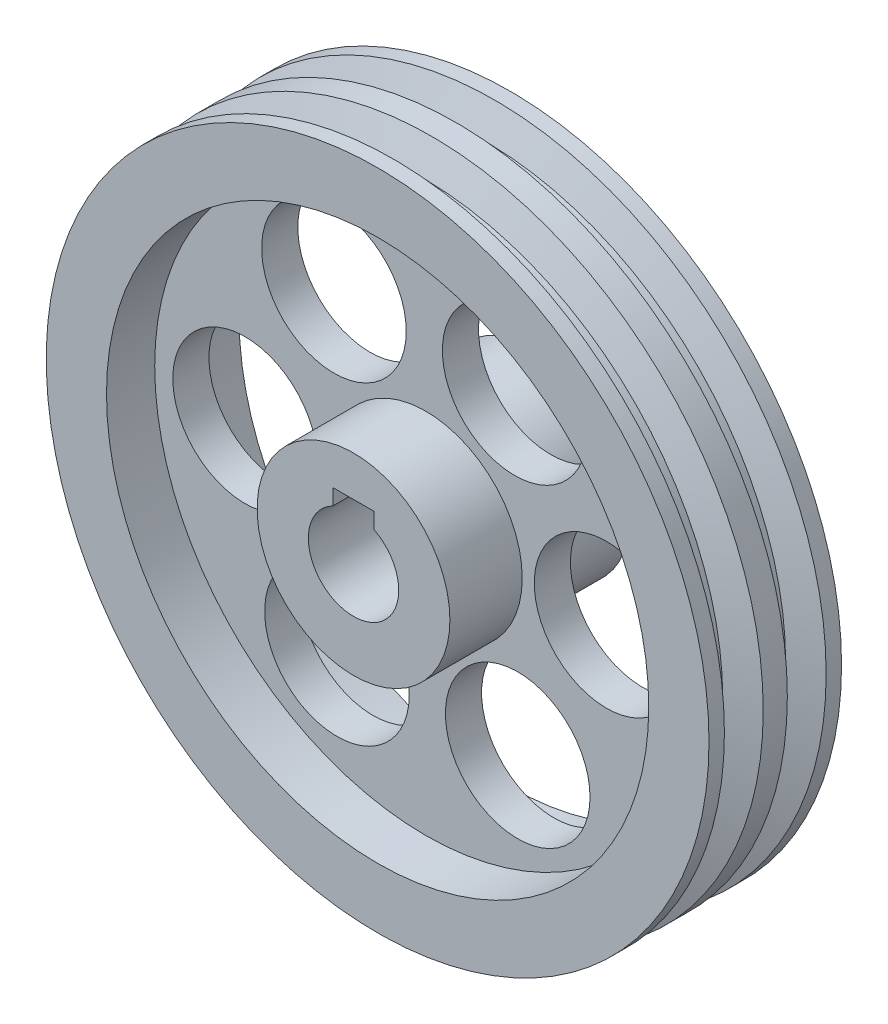
from build123d import *

# Parameters (mm, degrees)
SKETCH_2_R      = 16
EXTRUDE_5_DEPTH = 15
SKETCH_2_11_R   = 55
SKETCH_2_11_R_2 = 45
EXTRUDE_6_DEPTH = 11
SKETCH_2_20_R   = 45
SKETCH_2_20_R_2 = 12
SKETCH_2_20_R_3 = 16
EXTRUDE_9_DEPTH = 3


# Read off the part's stored shape, not the designer's step: 切除-旋转-薄壁6
with BuildPart() as part:
    # 草图2 → 凸台-拉伸5 (new, symmetric)
    with BuildSketch(Plane.XY):
        Circle(SKETCH_2_R)
        with BuildLine():
            ThreePointArc((-3.410963595, 6.679470589), (0, -7.5), (3.410963595, 6.679470589))
            Line((3.410963595, 6.679470589), (3.410963595, 9.309886023))
            Line((3.410963595, 9.309886023), (-3.410963595, 9.309886023))
            Line((-3.410963595, 9.309886023), (-3.410963595, 6.679470589))
        make_face(mode=Mode.SUBTRACT)
    extrude(amount=EXTRUDE_5_DEPTH, both=True)



with BuildPart() as body_2:
    # 草图2<11> → 凸台-拉伸6 (new, symmetric)
    with BuildSketch(Plane.XY):
        Circle(SKETCH_2_11_R)
        Circle(SKETCH_2_11_R_2, mode=Mode.SUBTRACT)
    extrude(amount=EXTRUDE_6_DEPTH, both=True)

    # 切除-旋转-薄壁6 outline → 切除-旋转-薄壁6 (revolve, cut)
    with BuildSketch(Plane.XZ):
        Polygon((55, -2), (50, -3.721638066), (50, -6.721638066), (55, -8.443276133), align=None)
        Polygon((50, 3.721638066), (55, 2), (55, 8.443276133), (50, 6.721638066), align=None)
    revolve(axis=Axis((0, 0, 0), (0, 0, 1)), mode=Mode.SUBTRACT)


with BuildPart() as part_1:
    add(part.part)

    add(body_2.part)  # 凸台-拉伸9 merges body 2
    # 草图2<20> → 凸台-拉伸9 (add, symmetric)
    with BuildSketch(Plane.XY):
        Circle(SKETCH_2_20_R)
        with Locations((-29.998597199, -0.290113977)):
            Circle(SKETCH_2_20_R_2, mode=Mode.SUBTRACT)
        with Locations((-15.250544673, 25.834490264)):
            Circle(SKETCH_2_20_R_2, mode=Mode.SUBTRACT)
        with Locations((14.748052526, 26.12460424)):
            Circle(SKETCH_2_20_R_2, mode=Mode.SUBTRACT)
        with Locations((29.998597199, 0.290113977)):
            Circle(SKETCH_2_20_R_2, mode=Mode.SUBTRACT)
        with Locations((15.250544673, -25.834490264)):
            Circle(SKETCH_2_20_R_2, mode=Mode.SUBTRACT)
        with Locations((-14.748052526, -26.12460424)):
            Circle(SKETCH_2_20_R_2, mode=Mode.SUBTRACT)
        Circle(SKETCH_2_20_R_3, mode=Mode.SUBTRACT)
    extrude(amount=EXTRUDE_9_DEPTH, both=True)


solid = part_1.part
